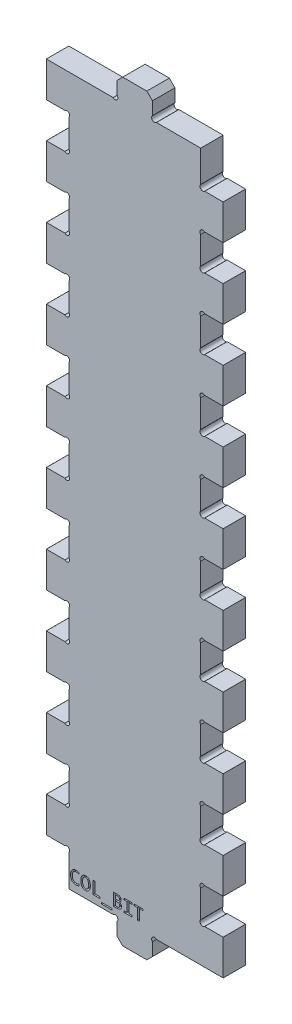
from build123d import *

# Parameters (mm, degrees)
SKETCH1_W           = 50.000000076
SKETCH1_H           = 200.000108
BOSS_EXTRUDE1_DEPTH = 6.35
SKETCH2_W           = 10.0000054
SKETCH2_H           = 6.35
BOSS_EXTRUDE2_DEPTH = 6.35
SKETCH8_W           = 6.35
SKETCH8_H           = 10.0000054
CUT_EXTRUDE6_DEPTH  = 213.416311942
LPATTERN4_COUNT     = 10
LPATTERN4_PITCH     = 20.0000108
SKETCH9_R           = 0.79375
CUT_EXTRUDE7_DEPTH  = 213.416311942
LPATTERN5_COUNT     = 9
LPATTERN5_PITCH     = 20.0000108
SKETCH10_R          = 0.79375
CUT_EXTRUDE8_DEPTH  = 213.416311942
CHAMFER1_SIZE       = 1.5875
SKETCH11_R          = 0.79375
CUT_EXTRUDE10_DEPTH = 213.416311942
SKETCH12_W          = 2.992753623
SKETCH12_H          = 0.405797101
CUT_EXTRUDE11_DEPTH = 2.54
SKETCH14_W          = 6.3240118
SKETCH14_H          = 10.0254054
CUT_EXTRUDE13_DEPTH = 213.416312063
LPATTERN7_COUNT     = 10
LPATTERN7_PITCH     = 20.0000108


with BuildPart() as part:
    # Sketch1 → Boss-Extrude1 (new body)
    with BuildSketch(Plane.XY):
        with Locations((25.000000038, 100.000054)):
            Rectangle(SKETCH1_W, SKETCH1_H)
    extrude(amount=BOSS_EXTRUDE1_DEPTH)

    # Sketch2 → Boss-Extrude2 (add)
    with BuildSketch(Plane.XY):
        with Locations((25.000000038, 203.175108)):
            Rectangle(SKETCH2_W, SKETCH2_H)
        with Locations((25.000000038, -3.175)):
            Rectangle(SKETCH2_W, SKETCH2_H)
    extrude(amount=BOSS_EXTRUDE2_DEPTH)

    # Sketch8 → Cut-Extrude6 (cut, through all)
    with BuildSketch(Plane.XY.offset(6.35)):
        with Locations((3.175, 5.0000027)):
            Rectangle(SKETCH8_W, SKETCH8_H)
        with Locations((46.825000076, 15.0000081)):
            Rectangle(SKETCH8_W, SKETCH8_H)
    cut_extrude6 = extrude(amount=-CUT_EXTRUDE6_DEPTH, mode=Mode.SUBTRACT)

    # LPattern4: Cut-Extrude6 ×10
    with Locations(*[(0, i * LPATTERN4_PITCH, 0) for i in range(1, LPATTERN4_COUNT)]):
        add(cut_extrude6, mode=Mode.SUBTRACT)

    # Sketch9 → Cut-Extrude7 (cut, through all)
    with BuildSketch(Plane.XY.offset(6.35)):
        with Locations((5.788733992, 29.438750192)):
            Circle(SKETCH9_R)
        with Locations((5.788733992, 20.561276808)):
            Circle(SKETCH9_R)
        with Locations((44.211266084, 19.438744792)):
            Circle(SKETCH9_R)
        with Locations((44.211266084, 10.561271408)):
            Circle(SKETCH9_R)
    cut_extrude7 = extrude(amount=-CUT_EXTRUDE7_DEPTH, mode=Mode.SUBTRACT)

    # LPattern5: Cut-Extrude7 ×9
    with Locations(*[(0, i * LPATTERN5_PITCH, 0) for i in range(1, LPATTERN5_COUNT)]):
        add(cut_extrude7, mode=Mode.SUBTRACT)

    # Sketch10 → Cut-Extrude8 (cut, through all)
    with BuildSketch(Plane.XY.offset(6.35)):
        with Locations((5.788733992, 9.438739392)):
            Circle(SKETCH10_R)
        with Locations((44.211266084, 190.561368608)):
            Circle(SKETCH10_R)
    extrude(amount=-CUT_EXTRUDE8_DEPTH, mode=Mode.SUBTRACT)

    # Chamfer1
    chamfer1_edges = [part.edges().sort_by_distance(p)[0] for p in [
        (30.000002738, -6.35, 3.175),
        (19.999997338, -6.35, 3.175),
        (19.999997338, 206.350108, 3.175),
        (30.000002738, 206.350108, 3.175),
    ]]
    chamfer(chamfer1_edges, length=CHAMFER1_SIZE)

    # Sketch11 → Cut-Extrude10 (cut, through all)
    with BuildSketch(Plane.XY):
        with Locations((19.43873133, 200.561374008)):
            Circle(SKETCH11_R)
        with Locations((30.561268746, 200.561374008)):
            Circle(SKETCH11_R)
        with Locations((19.43873133, -0.561266008)):
            Circle(SKETCH11_R)
        with Locations((30.561268746, -0.561266008)):
            Circle(SKETCH11_R)
    extrude(amount=CUT_EXTRUDE10_DEPTH, mode=Mode.SUBTRACT)

    # Sketch12 → Cut-Extrude11 (cut)
    # profile 1 of 7: a face of its own
    with BuildSketch(Plane.XY.offset(6.35)):
        with BuildLine():
            add(Edge.make_bspline(
                [(9.241681159, 2.133449275), (9.172051044, 2.109927689), (9.033143546, 2.063003673), (8.817184861, 2.016258906), (8.596831695, 1.986655982), (8.447883452, 1.983075114), (8.373021739, 1.981275362)],
                knots=[0, 0, 0, 0, 0.994474773, 1.983911717, 2.986709619, 4, 4, 4, 4], degree=3))
            add(Edge.make_bspline(
                [(8.373021739, 1.981275362), (8.313784998, 1.982651993), (8.198372663, 1.985334114), (8.030588838, 2.005924608), (7.873485396, 2.040845672), (7.726600188, 2.089029017), (7.590182892, 2.151662833), (7.464926827, 2.229338836), (7.350037868, 2.320024136), (7.24620649, 2.424813822), (7.15385938, 2.543315104), (7.074810551, 2.676017245), (7.006627123, 2.82128729), (6.953091148, 2.980629134), (6.908673059, 3.15233234), (6.87981115, 3.337634592), (6.861058715, 3.535914739), (6.858793273, 3.672578207), (6.857623188, 3.743163949)],
                knots=[0, 0, 0, 0, 1.072370344, 2.089324368, 3.054894172, 3.982167072, 4.883220536, 5.766007853, 6.644560033, 7.52738623, 8.430658994, 9.357672753, 10.318538922, 11.330575956, 12.396783324, 13.526066154, 14.722230158, 16, 16, 16, 16], degree=3))
            add(Edge.make_bspline(
                [(6.857623188, 3.743163949), (6.859099768, 3.811894194), (6.861991069, 3.946475335), (6.88143919, 4.143226133), (6.91603913, 4.32959635), (6.961848078, 4.505773361), (7.022537455, 4.669882056), (7.093581345, 4.8223251), (7.176989077, 4.961499651), (7.271585267, 5.087672029), (7.37787708, 5.200144093), (7.494493549, 5.299759358), (7.622442393, 5.384896086), (7.759886855, 5.456576142), (7.907409403, 5.513221896), (8.063835069, 5.552992406), (8.228717841, 5.578729312), (8.341483758, 5.581372394), (8.39917663, 5.582724638)],
                knots=[0, 0, 0, 0, 1.219579151, 2.388065895, 3.50339749, 4.580233523, 5.613961845, 6.603771101, 7.560489467, 8.487754287, 9.396405489, 10.300984393, 11.203313264, 12.1174982, 13.046432371, 14.000390303, 14.976967236, 16, 16, 16, 16], degree=3))
            add(Edge.make_bspline(
                [(8.39917663, 5.582724638), (8.438555235, 5.582309343), (8.516057544, 5.581491989), (8.629968521, 5.573830577), (8.739614404, 5.563507882), (8.878962347, 5.54070042), (9.048210995, 5.502545133), (9.177409016, 5.454467772), (9.241681159, 5.430550725)],
                knots=[0, 0, 0, 0, 0.82263702, 1.61905864, 2.384719601, 3.122514214, 4.568537041, 6, 6, 6, 6], degree=3))
            Line((9.241681159, 5.430550725), (9.241681159, 4.974028986))
            add(Edge.make_bspline(
                [(9.241681159, 4.974028986), (9.210428334, 4.990006992), (9.148495702, 5.021670049), (9.052319362, 5.062256406), (8.954683284, 5.096988724), (8.854604056, 5.125716119), (8.752002187, 5.14892655), (8.645079855, 5.16574771), (8.533556351, 5.175104658), (8.457579692, 5.176313541), (8.418990942, 5.176927536)],
                knots=[0, 0, 0, 0, 0.983614603, 1.949194672, 2.923566415, 3.886871985, 4.866016098, 5.870457402, 6.918399582, 8, 8, 8, 8], degree=3))
            add(Edge.make_bspline(
                [(8.418990942, 5.176927536), (8.379540437, 5.176079098), (8.302305834, 5.174418059), (8.189514247, 5.154935509), (8.082072639, 5.126356351), (7.980910785, 5.084530852), (7.886034111, 5.032502436), (7.799180636, 4.967955487), (7.718683438, 4.894297811), (7.646257974, 4.809542217), (7.582015154, 4.714734893), (7.525707459, 4.609928391), (7.476212546, 4.495595378), (7.436612374, 4.370856667), (7.40360209, 4.237288013), (7.381151341, 4.0943738), (7.367596447, 3.942363856), (7.365795755, 3.838037954), (7.364869565, 3.784377717)],
                knots=[0, 0, 0, 0, 0.961408976, 1.882207611, 2.784411545, 3.668921893, 4.545980223, 5.417431557, 6.302341026, 7.202770486, 8.13058038, 9.09095177, 10.101446619, 11.165409356, 12.279999165, 13.455113719, 14.691032636, 16, 16, 16, 16], degree=3))
            add(Edge.make_bspline(
                [(7.364869565, 3.784377717), (7.365523252, 3.728344917), (7.366789278, 3.619823606), (7.379558455, 3.462300155), (7.400914423, 3.315410374), (7.429653576, 3.178771879), (7.46768467, 3.052738296), (7.514340084, 2.937558302), (7.569096818, 2.83261959), (7.632656016, 2.738776906), (7.704247644, 2.655174316), (7.785167308, 2.583964093), (7.872643742, 2.521558623), (7.969623736, 2.473121664), (8.07317629, 2.433337078), (8.185219091, 2.407283692), (8.304581636, 2.389932746), (8.386957714, 2.388043454), (8.429294384, 2.387072464)],
                knots=[0, 0, 0, 0, 1.34450783, 2.603970389, 3.789343747, 4.904814261, 5.951782154, 6.944310538, 7.883053746, 8.786934864, 9.658944679, 10.516661903, 11.367981323, 12.229999549, 13.110838734, 14.024275634, 14.984588823, 16, 16, 16, 16], degree=3))
            add(Edge.make_bspline(
                [(8.429294384, 2.387072464), (8.465779767, 2.387597048), (8.538107423, 2.38863697), (8.645283552, 2.399522956), (8.750137307, 2.415958868), (8.886658962, 2.446880566), (9.053174198, 2.499895316), (9.178890482, 2.559967273), (9.241681159, 2.589971014)],
                knots=[0, 0, 0, 0, 0.776705674, 1.539720753, 2.291683871, 3.035542813, 4.519362263, 6, 6, 6, 6], degree=3))
            Line((9.241681159, 2.589971014), (9.241681159, 2.133449275))
        make_face()
    # profile 2 of 7: a face of its own
    with BuildSketch(Plane.XY.offset(6.35)):
        with BuildLine():
            add(Edge.make_bspline(
                [(12.437333333, 3.804984601), (12.43601793, 3.728845569), (12.433477868, 3.581820029), (12.412555032, 3.36938994), (12.379376875, 3.172756522), (12.330969947, 2.992228254), (12.270207249, 2.827841825), (12.201632231, 2.677433039), (12.122296119, 2.542200367), (12.033425875, 2.421642575), (11.93521557, 2.316801835), (11.83024605, 2.224639641), (11.715040792, 2.149760737), (11.593748947, 2.087488378), (11.46639255, 2.040198208), (11.335297313, 2.005802001), (11.200480678, 1.985740262), (11.109574639, 1.982770552), (11.063805254, 1.981275362)],
                knots=[0, 0, 0, 0, 1.423082774, 2.747992794, 3.986236128, 5.147128242, 6.236197569, 7.259302453, 8.233395673, 9.161912359, 10.053001658, 10.914402565, 11.766421957, 12.614596425, 13.458547256, 14.300675266, 15.144423756, 16, 16, 16, 16], degree=3))
            add(Edge.make_bspline(
                [(11.063805254, 1.981275362), (11.00982167, 1.982748877), (10.90503797, 1.985609012), (10.753247627, 2.009107372), (10.61209879, 2.046739236), (10.481460474, 2.10014703), (10.362354069, 2.168847955), (10.253014391, 2.250313215), (10.155178714, 2.346380358), (10.067688025, 2.455479173), (9.991225346, 2.57801454), (9.925820989, 2.713217929), (9.870217267, 2.860721403), (9.825427788, 3.020431097), (9.790831632, 3.191607172), (9.766862896, 3.373545929), (9.751248041, 3.565618457), (9.749713701, 3.697162748), (9.748927536, 3.764563406)],
                knots=[0, 0, 0, 0, 1.030115455, 1.999483942, 2.924432069, 3.813267415, 4.685316872, 5.542716903, 6.40939724, 7.295524004, 8.206506083, 9.160640047, 10.158252241, 11.211975818, 12.323750963, 13.4892538, 14.713543989, 16, 16, 16, 16], degree=3))
            add(Edge.make_bspline(
                [(9.748927536, 3.764563406), (9.75034993, 3.839899952), (9.753100111, 3.985562242), (9.772663246, 4.196517882), (9.806314436, 4.391935553), (9.85387434, 4.571929), (9.913447346, 4.736363234), (9.982511501, 4.886261547), (10.060393977, 5.02196585), (10.149995451, 5.1415857), (10.248069311, 5.246740581), (10.353150126, 5.338639822), (10.467324173, 5.414475143), (10.587959001, 5.476661318), (10.71489283, 5.523635893), (10.845647532, 5.558318613), (10.980237662, 5.578238608), (11.071140058, 5.581222372), (11.116907609, 5.582724638)],
                knots=[0, 0, 0, 0, 1.41309666, 2.732205102, 3.969807196, 5.128608405, 6.219709524, 7.24631839, 8.221244419, 9.148965463, 10.043106611, 10.914447659, 11.761129373, 12.607796584, 13.454637821, 14.294855332, 15.141493535, 16, 16, 16, 16], degree=3))
            add(Edge.make_bspline(
                [(11.116907609, 5.582724638), (11.17088216, 5.581205794), (11.27590958, 5.578250322), (11.427896122, 5.555314891), (11.568904598, 5.516302026), (11.699067312, 5.462137448), (11.818768671, 5.393499895), (11.927876493, 5.311457627), (12.026657504, 5.216102795), (12.113534025, 5.106814066), (12.190935518, 4.985092958), (12.258438921, 4.851223539), (12.313370706, 4.70389839), (12.359381712, 4.54523559), (12.394485192, 4.375040237), (12.419706837, 4.194233125), (12.434935452, 4.003127673), (12.436520905, 3.872117664), (12.437333333, 3.804984601)],
                knots=[0, 0, 0, 0, 1.031800753, 2.007749398, 2.930678117, 3.822900438, 4.696376593, 5.562252438, 6.426830471, 7.314406963, 8.225311853, 9.18096675, 10.175487812, 11.227471919, 12.337140194, 13.495232744, 14.716489688, 16, 16, 16, 16], degree=3))
        make_face()
        with BuildLine():
            add(Edge.make_bspline(
                [(11.930086957, 3.770903986), (11.929319843, 3.821632923), (11.927816655, 3.921038275), (11.920712966, 4.066869863), (11.904833817, 4.205823063), (11.885807956, 4.337988389), (11.860060806, 4.462613221), (11.826549375, 4.578507216), (11.787612768, 4.686148555), (11.739840943, 4.784056517), (11.685155945, 4.872228152), (11.623993703, 4.951423441), (11.5538972, 5.018635198), (11.476994298, 5.07596847), (11.392299535, 5.121667179), (11.299078477, 5.154455719), (11.197470152, 5.173515246), (11.127028826, 5.175767608), (11.090752717, 5.176927536)],
                knots=[0, 0, 0, 0, 1.323673599, 2.593790554, 3.807090586, 4.970987518, 6.076778004, 7.123914636, 8.116191169, 9.059475772, 9.960330598, 10.819370074, 11.662669578, 12.485668992, 13.315223066, 14.163241623, 15.054100047, 16, 16, 16, 16], degree=3))
            add(Edge.make_bspline(
                [(11.090752717, 5.176927536), (11.055535534, 5.175461751), (10.986900043, 5.172605053), (10.887318918, 5.153125777), (10.79613613, 5.117548722), (10.712780008, 5.069316432), (10.637158324, 5.009558746), (10.569697125, 4.938452065), (10.507410026, 4.859424967), (10.453429163, 4.769728909), (10.407632774, 4.671137643), (10.365331906, 4.565176701), (10.332511626, 4.450170111), (10.303471352, 4.328407128), (10.282685987, 4.200398216), (10.267948451, 4.068117388), (10.257856916, 3.931950555), (10.256740918, 3.839876258), (10.256173913, 3.793096014)],
                knots=[0, 0, 0, 0, 0.938104053, 1.828290259, 2.688226573, 3.533173995, 4.38495139, 5.245952462, 6.138444459, 7.060521377, 8.026891732, 9.031849607, 10.096184638, 11.209149641, 12.36492099, 13.547735175, 14.754076334, 16, 16, 16, 16], degree=3))
            add(Edge.make_bspline(
                [(10.256173913, 3.793096014), (10.256797119, 3.741828752), (10.258012335, 3.641860407), (10.267069923, 3.495124897), (10.280750161, 3.355393901), (10.301327316, 3.222814719), (10.327849907, 3.098556572), (10.361167952, 2.983052236), (10.400604405, 2.876287784), (10.446937421, 2.778509345), (10.501329196, 2.690699423), (10.561953655, 2.611969745), (10.632088589, 2.54552854), (10.707136232, 2.48699193), (10.792035817, 2.442375974), (10.884293742, 2.409741059), (10.985072207, 2.39040114), (11.054737023, 2.388206869), (11.090752717, 2.387072464)],
                knots=[0, 0, 0, 0, 1.340540585, 2.613980496, 3.843097936, 5.010722051, 6.120504555, 7.163418743, 8.151508278, 9.093960035, 9.987380757, 10.848401497, 11.683877306, 12.507385072, 13.329500698, 14.179475102, 15.05881515, 16, 16, 16, 16], degree=3))
            add(Edge.make_bspline(
                [(11.090752717, 2.387072464), (11.126001249, 2.388400933), (11.194492349, 2.390982269), (11.293349403, 2.412252809), (11.384928334, 2.446356466), (11.468688325, 2.494724667), (11.545078889, 2.554430013), (11.613424744, 2.625274866), (11.675644785, 2.704784284), (11.730268109, 2.794425908), (11.778269739, 2.892425457), (11.819561695, 2.998825819), (11.854377033, 3.112719034), (11.881459116, 3.234495751), (11.903948197, 3.361899639), (11.918251486, 3.494578643), (11.928424315, 3.631253151), (11.929526842, 3.723858103), (11.930086957, 3.770903986)],
                knots=[0, 0, 0, 0, 0.936906737, 1.820494917, 2.676828052, 3.526792157, 4.383009914, 5.247809723, 6.13916262, 7.06372975, 8.034989121, 9.038664354, 10.096936984, 11.200050273, 12.355522744, 13.536827286, 14.74863997, 16, 16, 16, 16], degree=3))
        make_face(mode=Mode.SUBTRACT)
    # profile 3 of 7: a face of its own
    with BuildSketch(Plane.XY.offset(6.35)):
        Polygon((15.227188406, 2.032), (13.198202899, 2.032), (13.198202899, 5.532), (13.705449275, 5.532), (13.705449275, 2.437797101), (15.227188406, 2.437797101), align=None)
    # profile 4 of 7: a face of its own
    with BuildSketch(Plane.XY.offset(6.35)):
        with Locations((17.078637682, 1.118956522)):
            Rectangle(SKETCH12_W, SKETCH12_H)
    # profile 5 of 7: a face of its own
    with BuildSketch(Plane.XY.offset(6.35)):
        with BuildLine():
            add(Edge.make_bspline(
                [(21.26342029, 3.091669384), (21.262206874, 3.050385061), (21.259837655, 2.969776577), (21.241270646, 2.852775616), (21.211235382, 2.742746616), (21.168333223, 2.640303308), (21.113702402, 2.545643546), (21.050317486, 2.457397294), (20.975070473, 2.377922201), (20.889772489, 2.306440675), (20.794858812, 2.242795359), (20.690596084, 2.18748094), (20.577130482, 2.139609619), (20.454547718, 2.10036785), (20.323837889, 2.069809065), (20.185911584, 2.047353759), (20.04070608, 2.035042856), (19.941431185, 2.033029281), (19.890684783, 2.032)],
                knots=[0, 0, 0, 0, 1.013216857, 1.978326566, 2.900521816, 3.80762901, 4.696652207, 5.578905641, 6.469134838, 7.376056482, 8.306156408, 9.269586241, 10.269510869, 11.325927403, 12.425683058, 13.562442612, 14.753992443, 16, 16, 16, 16], degree=3))
            Line((19.890684783, 2.032), (18.980811594, 2.032))
            Line((18.980811594, 2.032), (18.980811594, 5.532))
            Line((18.980811594, 5.532), (19.986586051, 5.532))
            add(Edge.make_bspline(
                [(19.986586051, 5.532), (20.034164889, 5.531535569), (20.126272402, 5.530636482), (20.25954255, 5.519667014), (20.38379881, 5.504518722), (20.498914496, 5.481893726), (20.604628307, 5.451308424), (20.701959554, 5.416405711), (20.789572443, 5.373426153), (20.867919253, 5.323958732), (20.937781399, 5.26853573), (20.99745473, 5.205137465), (21.048789581, 5.135944546), (21.090264233, 5.059534502), (21.122872976, 4.97679493), (21.145711635, 4.887338631), (21.159224876, 4.791622), (21.1610388, 4.725734298), (21.161971014, 4.691873188)],
                knots=[0, 0, 0, 0, 1.388776146, 2.688521212, 3.90167895, 5.042289038, 6.109239049, 7.11226345, 8.057476407, 8.951978552, 9.813306123, 10.653548746, 11.486644475, 12.322022467, 13.184316581, 14.076721024, 15.011585489, 16, 16, 16, 16], degree=3))
            add(Edge.make_bspline(
                [(21.161971014, 4.691873188), (21.160326095, 4.64683958), (21.157124584, 4.559190529), (21.131358633, 4.432414464), (21.088347643, 4.315599145), (21.038497604, 4.226419604), (20.989790174, 4.161446482), (20.947487409, 4.116089651), (20.899726236, 4.07422866), (20.847102918, 4.035062702), (20.78894801, 3.999417594), (20.725302523, 3.966972848), (20.656409422, 3.937652339), (20.608077101, 3.921184705), (20.583393116, 3.912774457)],
                knots=[0, 0, 0, 0, 1.542514348, 3.00220039, 4.41170875, 5.794260582, 6.486040375, 7.190794555, 7.915677968, 8.659981338, 9.436469499, 10.250434215, 11.106472525, 12, 12, 12, 12], degree=3))
            add(Edge.make_bspline(
                [(20.583393116, 3.912774457), (20.628484999, 3.902011395), (20.718538493, 3.880516367), (20.824559751, 3.832821667), (20.9046532, 3.787275686), (20.960505709, 3.746913217), (21.012991814, 3.702676214), (21.061460622, 3.653252693), (21.105957568, 3.599317646), (21.145909364, 3.540610374), (21.17962912, 3.476415301), (21.210348606, 3.40855291), (21.233765254, 3.335373771), (21.251446717, 3.258016238), (21.261838218, 3.176230754), (21.262885916, 3.120231516), (21.26342029, 3.091669384)],
                knots=[0, 0, 0, 0, 1.670885493, 3.336943679, 4.174711656, 4.995358125, 5.821090152, 6.65083528, 7.491206374, 8.34319308, 9.209637874, 10.10658404, 11.029731221, 11.978595832, 12.968992875, 14, 14, 14, 14], degree=3))
        make_face()
        with BuildLine():
            add(Edge.make_bspline(
                [(20.654724638, 4.626089674), (20.653268922, 4.660048449), (20.650410745, 4.726723694), (20.629853277, 4.807369738), (20.60577815, 4.867736504), (20.581410006, 4.909565534), (20.550277635, 4.947626652), (20.513697298, 4.982326322), (20.47131988, 5.014695154), (20.421405122, 5.042180728), (20.36483904, 5.066681783), (20.301250998, 5.08803203), (20.230013805, 5.105576987), (20.150244735, 5.118164465), (20.061734794, 5.124904903), (19.999806596, 5.125758488), (19.967564312, 5.126202899)],
                knots=[0, 0, 0, 0, 1.467350645, 2.88102155, 3.572915596, 4.274650825, 4.965411238, 5.692918483, 6.45179769, 7.26549663, 8.150919223, 9.115896111, 10.16367939, 11.321101063, 12.605258578, 14, 14, 14, 14], degree=3))
            Line((19.967564312, 5.126202899), (19.488057971, 5.126202899))
            Line((19.488057971, 5.126202899), (19.488057971, 4.060985507))
            Line((19.488057971, 4.060985507), (19.951712862, 4.060985507))
            add(Edge.make_bspline(
                [(19.951712862, 4.060985507), (20.002285049, 4.062611875), (20.099055898, 4.065723962), (20.216147577, 4.086765768), (20.301517596, 4.111515143), (20.358599399, 4.137176304), (20.41260192, 4.164115364), (20.460714748, 4.197950935), (20.504926514, 4.235239355), (20.543723416, 4.277339872), (20.577520292, 4.323740657), (20.605294605, 4.37495064), (20.627715016, 4.430716224), (20.643369893, 4.491444911), (20.653097322, 4.557085787), (20.654169282, 4.602540649), (20.654724638, 4.626089674)],
                knots=[0, 0, 0, 0, 2.073538655, 3.967755928, 4.862618563, 5.712230629, 6.531505899, 7.334196252, 8.118305519, 8.900614993, 9.67674368, 10.467342855, 11.284464589, 12.136217, 13.034420764, 14, 14, 14, 14], degree=3))
        make_face(mode=Mode.SUBTRACT)
        with BuildLine():
            add(Edge.make_bspline(
                [(20.756173913, 3.073440217), (20.755647901, 3.095409939), (20.75461508, 3.138547266), (20.744008243, 3.201632751), (20.726622508, 3.261208573), (20.702479543, 3.317243877), (20.672659966, 3.369761334), (20.635535005, 3.417440346), (20.593216354, 3.46182108), (20.543973189, 3.50116604), (20.488901208, 3.535846195), (20.428855844, 3.567181811), (20.363071871, 3.593997671), (20.291680265, 3.615962893), (20.215122291, 3.633476451), (20.133785421, 3.645755118), (20.047525473, 3.654174021), (19.988456872, 3.654843708), (19.958053442, 3.655188406)],
                knots=[0, 0, 0, 0, 0.948445084, 1.862262358, 2.754366203, 3.623615494, 4.492864785, 5.355796555, 6.227589923, 7.136690505, 8.070741307, 9.035595869, 10.059344591, 11.135152229, 12.259281394, 13.44900263, 14.686966176, 16, 16, 16, 16], degree=3))
            Line((19.958053442, 3.655188406), (19.488057971, 3.655188406))
            Line((19.488057971, 3.655188406), (19.488057971, 2.437797101))
            Line((19.488057971, 2.437797101), (19.973904891, 2.437797101))
            add(Edge.make_bspline(
                [(19.973904891, 2.437797101), (20.005888391, 2.438205025), (20.067562755, 2.438991631), (20.156998315, 2.446376497), (20.240296172, 2.457661851), (20.317011117, 2.475295336), (20.387587557, 2.496678652), (20.452238956, 2.522399519), (20.51001783, 2.554509234), (20.562555926, 2.59002351), (20.608081503, 2.631962755), (20.648155941, 2.678825178), (20.681482963, 2.731906471), (20.709289471, 2.789819802), (20.730794466, 2.853143616), (20.745694706, 2.921734069), (20.754290456, 2.995813426), (20.755532351, 3.046998183), (20.756173913, 3.073440217)],
                knots=[0, 0, 0, 0, 1.326701194, 2.558302104, 3.720902774, 4.811133236, 5.820090824, 6.778795896, 7.691204955, 8.557756331, 9.403467856, 10.251165954, 11.10865784, 11.996033528, 12.91113804, 13.8765245, 14.903013039, 16, 16, 16, 16], degree=3))
        make_face(mode=Mode.SUBTRACT)
    # profile 6 of 7: a face of its own
    with BuildSketch(Plane.XY.offset(6.35)):
        Polygon((22.835884058, 5.126202899), (22.024289855, 5.126202899), (22.024289855, 5.532), (24.154724638, 5.532), (24.154724638, 5.126202899), (23.343130435, 5.126202899), (23.343130435, 2.437797101), (24.154724638, 2.437797101), (24.154724638, 2.032), (22.024289855, 2.032), (22.024289855, 2.437797101), (22.835884058, 2.437797101), align=None)
    # profile 7 of 7: a face of its own
    with BuildSketch(Plane.XY.offset(6.35)):
        Polygon((27.350376812, 5.126202899), (26.335884058, 5.126202899), (26.335884058, 2.032), (25.828637681, 2.032), (25.828637681, 5.126202899), (24.814144928, 5.126202899), (24.814144928, 5.532), (27.350376812, 5.532), align=None)
    extrude(amount=-CUT_EXTRUDE11_DEPTH, mode=Mode.SUBTRACT)

    # Sketch14 → Cut-Extrude13 (cut, through all)
    with BuildSketch(Plane.XY.offset(6.35)):
        with Locations((3.175, 5.0000027)):
            Rectangle(SKETCH14_W, SKETCH14_H)
        with Locations((46.825000076, 15.0000081)):
            Rectangle(SKETCH14_W, SKETCH14_H)
    cut_extrude13 = extrude(amount=-CUT_EXTRUDE13_DEPTH, mode=Mode.SUBTRACT)

    # LPattern7: Cut-Extrude13 ×10
    with Locations(*[(0, i * LPATTERN7_PITCH, 0) for i in range(1, LPATTERN7_COUNT)]):
        add(cut_extrude13, mode=Mode.SUBTRACT)


solid = part.part
